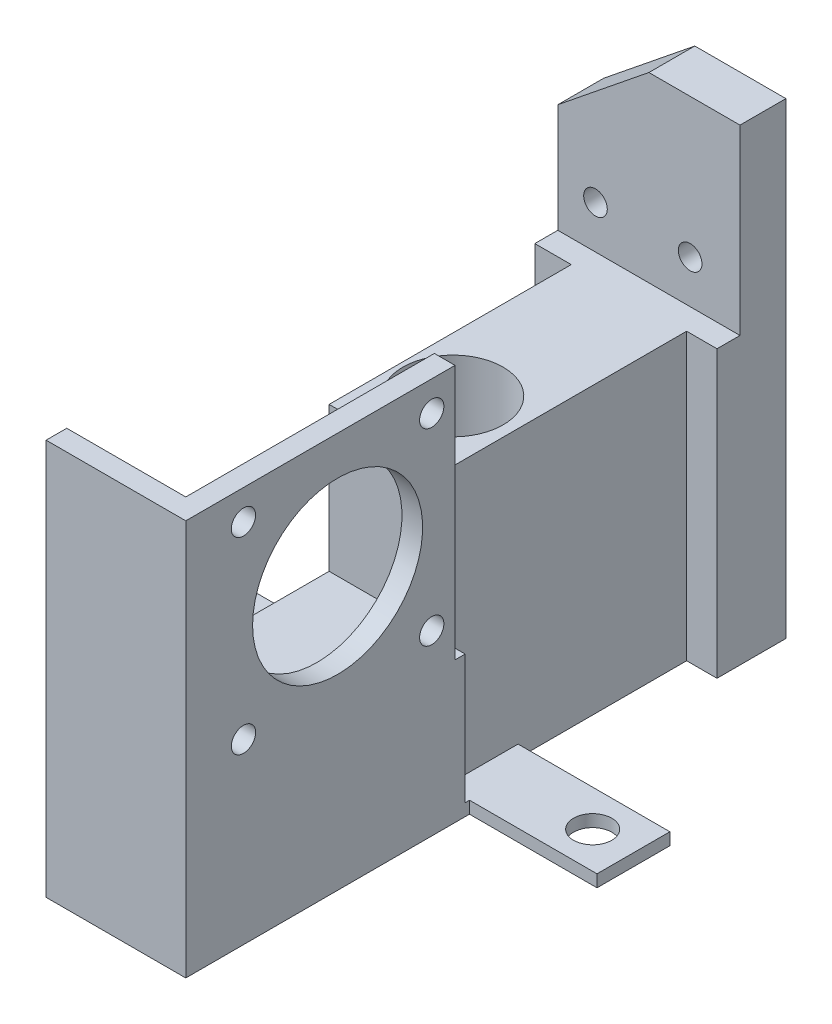
from build123d import *

# Parameters (mm, degrees)
SKETCH1_R           = 3.15
SKETCH1_R_2         = 8.25
BOSS_EXTRUDE1_DEPTH = 2
BOSS_EXTRUDE2_DEPTH = 45
SKETCH3_R           = 8.25
CUT_EXTRUDE1_DEPTH  = 104.812694214
SKETCH4_W           = 30
SKETCH4_H           = 7.560001502
BOSS_EXTRUDE3_DEPTH = 30
SKETCH5_R           = 1.945
CUT_EXTRUDE2_DEPTH  = 130.889649736
CUT_EXTRUDE3_DEPTH  = 120.90444312
SKETCH10_W          = 23
SKETCH10_H          = 46
BOSS_EXTRUDE4_DEPTH = 21.2
SKETCH11_W          = 22.207892016
SKETCH11_H          = 46.715728752
CUT_EXTRUDE4_DEPTH  = 119.384613888
SKETCH12_W          = 0.6
SKETCH12_H          = 23.8
CUT_EXTRUDE5_DEPTH  = 118.813722566
BOSS_EXTRUDE5_DEPTH = 42
SKETCH14_R          = 14
CUT_EXTRUDE6_DEPTH  = 119.420577709
SKETCH15_R          = 2
CUT_EXTRUDE7_DEPTH  = 119.420577709
CUT_EXTRUDE8_DEPTH  = 134.688429845


with BuildPart() as part:
    # Sketch1 → Boss-Extrude1 (new body)
    with BuildSketch(Plane(origin=(0, 0, 0), x_dir=(1, 0, 0), z_dir=(0, 1, 0))):
        Polygon((-48.732366868, 38.443096859), (21.267633132, 38.443096859), (21.267633132, -31.556903141), (21.267633132, -79.857572586), (-48.732366868, -79.857572586), (-48.732366868, -31.556903141), align=None)
        with Locations((-42.016638116, 31.727368106)):
            Circle(SKETCH1_R, mode=Mode.SUBTRACT)
        with Locations((14.551904379, 31.727368106)):
            Circle(SKETCH1_R, mode=Mode.SUBTRACT)
        with Locations((14.551904379, -24.841174389)):
            Circle(SKETCH1_R, mode=Mode.SUBTRACT)
        with Locations((-42.016638116, -24.841174389)):
            Circle(SKETCH1_R, mode=Mode.SUBTRACT)
        with Locations((-13.732366868, -19.556903141)):
            Circle(SKETCH1_R_2, mode=Mode.SUBTRACT)
    extrude(amount=BOSS_EXTRUDE1_DEPTH)

    # Sketch2 → Boss-Extrude2 (add)
    with BuildSketch(Plane(origin=(0, 2, 0), x_dir=(1, 0, 0), z_dir=(0, 1, 0))):
        Polygon((-28.732366868, 20.263098361), (1.267633132, 20.263098361), (1.267633132, 8.916503275), (-3.732366868, 8.916503275), (-3.732366868, -31.556903141), (-22.732366868, -31.556903141), (-22.732366868, 5.987652995), (-22.732366868, 8.916503275), (-28.732366868, 8.916503275), (-28.732366868, 9.103096859), align=None)
    extrude(amount=BOSS_EXTRUDE2_DEPTH)

    # Sketch3 → Cut-Extrude1 (cut, through all)
    with BuildSketch(Plane.XZ.offset(-2)):
        with Locations((-13.732366868, 19.556903141)):
            Circle(SKETCH3_R)
    extrude(amount=-CUT_EXTRUDE1_DEPTH, mode=Mode.SUBTRACT)

    # Sketch4 → Boss-Extrude3 (add)
    with BuildSketch(Plane(origin=(0, 47, 0), x_dir=(1, 0, 0), z_dir=(0, 1, 0))):
        with Locations((-13.732366868, 16.48309761)):
            Rectangle(SKETCH4_W, SKETCH4_H)
    extrude(amount=BOSS_EXTRUDE3_DEPTH)

    # Sketch5 → Cut-Extrude2 (cut, through all)
    with BuildSketch(Plane.XY.offset(-12.703096859)):
        with Locations((-22.527366868, 54.069519899)):
            Circle(SKETCH5_R)
        with Locations((-6.937366868, 54.069519899)):
            Circle(SKETCH5_R)
    extrude(amount=-CUT_EXTRUDE2_DEPTH, mode=Mode.SUBTRACT)

    # Sketch6 → Cut-Extrude3 (cut, through all)
    with BuildSketch(Plane(origin=(0, 2, 0), x_dir=(1, 0, 0), z_dir=(0, 1, 0))):
        Polygon((-48.732366868, -18.841174389), (-22.732366868, -18.841174389), (-22.732366868, 8.916503275), (-28.732366868, 8.916503275), (-28.732366868, 12.703096859), (-28.732366868, 20.263098361), (1.267633132, 20.263098361), (1.267633132, 8.916503275), (-3.732366868, 8.916503275), (-3.732366868, -18.841174389), (21.267633132, -18.841174389), (21.267633132, 38.443096859), (-48.732366868, 38.443096859), align=None)
        Polygon((-48.732366868, -30.841174389), (-44.940258884, -30.841174389), (-44.940258884, -77.556903141), (0.267633132, -77.556903141), (0.267633132, -30.841174389), (21.267633132, -30.841174389), (21.267633132, -79.857572586), (-48.732366868, -79.857572586), align=None)
    extrude(amount=-CUT_EXTRUDE3_DEPTH, mode=Mode.SUBTRACT)

    # Sketch10 → Boss-Extrude4 (add)
    with BuildSketch(Plane(origin=(0, 2, 0), x_dir=(1, 0, 0), z_dir=(0, 1, 0))):
        with Locations((-11.232366868, -54.556903141)):
            Rectangle(SKETCH10_W, SKETCH10_H)
    extrude(amount=BOSS_EXTRUDE4_DEPTH)

    # Sketch11 → Cut-Extrude4 (cut, through all)
    with BuildSketch(Plane(origin=(0, 2, 0), x_dir=(1, 0, 0), z_dir=(0, 1, 0))):
        with Locations((-33.836312876, -54.199038765)):
            Rectangle(SKETCH11_W, SKETCH11_H)
    extrude(amount=-CUT_EXTRUDE4_DEPTH, mode=Mode.SUBTRACT)

    # Sketch12 → Cut-Extrude5 (cut, through all)
    with BuildSketch(Plane.ZY.offset(22.732366868)):
        with Locations((31.256903141, 35.1)):
            Rectangle(SKETCH12_W, SKETCH12_H)
    extrude(amount=-CUT_EXTRUDE5_DEPTH, mode=Mode.SUBTRACT)

    # Sketch13 → Boss-Extrude5 (add)
    with BuildSketch(Plane(origin=(0, 23.2, 0), x_dir=(1, 0, 0), z_dir=(0, 1, 0))):
        Polygon((0.267633132, -77.556903141), (-22.732366868, -77.556903141), (-22.732366868, -74.156903141), (-3.132366868, -74.156903141), (-3.132366868, -33.22347783), (0.267633132, -33.22347783), (0.267633132, -74.156903141), align=None)
    extrude(amount=BOSS_EXTRUDE5_DEPTH)

    # Sketch14 → Cut-Extrude6 (cut, through all)
    with BuildSketch(Plane.ZY.offset(3.132366868)):
        with Locations((52.556903141, 44.785296811)):
            Circle(SKETCH14_R)
    extrude(amount=-CUT_EXTRUDE6_DEPTH, mode=Mode.SUBTRACT)

    # Sketch15 → Cut-Extrude7 (cut, through all)
    with BuildSketch(Plane.ZY.offset(3.132366868)):
        with Locations((68.056903141, 29.285296811)):
            Circle(SKETCH15_R)
        with Locations((37.056903141, 29.285296811)):
            Circle(SKETCH15_R)
        with Locations((37.056903141, 60.285296811)):
            Circle(SKETCH15_R)
        with Locations((68.056903141, 60.285296811)):
            Circle(SKETCH15_R)
    extrude(amount=-CUT_EXTRUDE7_DEPTH, mode=Mode.SUBTRACT)

    # Sketch16 → Cut-Extrude8 (cut, through all)
    with BuildSketch(Plane(origin=(0, 0, -20.263098361), x_dir=(-1, 0, 0), z_dir=(0, 0, -1))):
        Polygon((28.732366868, 64.906617154), (13.732366868, 77), (28.732366868, 77), align=None)
    extrude(amount=-CUT_EXTRUDE8_DEPTH, mode=Mode.SUBTRACT)


solid = part.part
